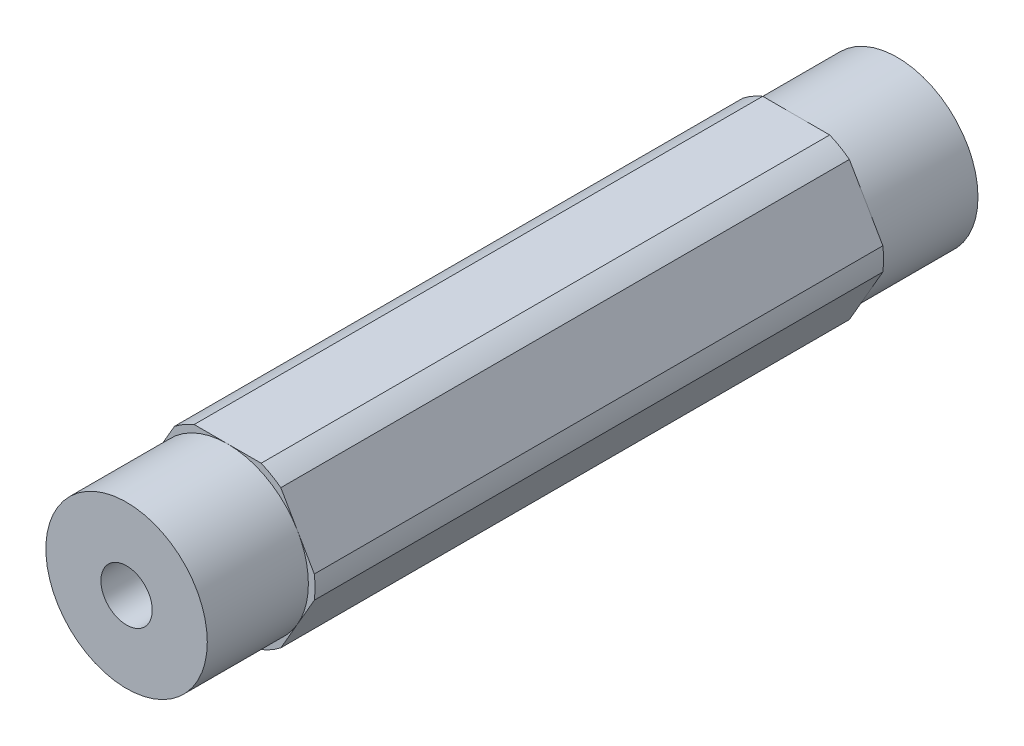
from build123d import *

# Parameters (mm, degrees)
BOSS_EXTRUDE1_DEPTH = 30.31109
SKETCH2_OUTSIDE_W   = 29.394
SKETCH2_OUTSIDE_H   = 27.43
SKETCH2_OUTSIDE_R   = 6.35
CUT_EXTRUDE2_DEPTH  = 7.9502
SKETCH3_OUTSIDE_W   = 29.394
SKETCH3_OUTSIDE_H   = 27.43
SKETCH3_OUTSIDE_R   = 6.875
CUT_EXTRUDE4_DEPTH  = 62.393277656
SKETCH4_R           = 2.0193
CUT_EXTRUDE5_DEPTH  = 62.340336101


with BuildPart() as part:
    # Sketch1 → Boss-Extrude1 (new, symmetric)
    with BuildSketch(Plane.XY):
        Polygon((7.332348419, 0), (3.666174209, 6.35), (-3.666174209, 6.35), (-7.332348419, 0), (-3.666174209, -6.35), (3.666174209, -6.35), align=None)
    extrude(amount=BOSS_EXTRUDE1_DEPTH, both=True)

    # Sketch2 outside → Cut-Extrude2 (cut)
    with BuildSketch(Plane.XY.offset(30.31109)):
        Rectangle(SKETCH2_OUTSIDE_W, SKETCH2_OUTSIDE_H)
        Circle(SKETCH2_OUTSIDE_R, mode=Mode.SUBTRACT)
    cut_extrude2 = extrude(amount=-CUT_EXTRUDE2_DEPTH, mode=Mode.SUBTRACT)

    # Sketch3 outside → Cut-Extrude4 (cut, through all)
    with BuildSketch(Plane.XY.offset(30.31109)):
        Rectangle(SKETCH3_OUTSIDE_W, SKETCH3_OUTSIDE_H)
        Circle(SKETCH3_OUTSIDE_R, mode=Mode.SUBTRACT)
    extrude(amount=-CUT_EXTRUDE4_DEPTH, mode=Mode.SUBTRACT)

    # Mirror1: Cut-Extrude2 across plane
    add(cut_extrude2.mirror(Plane.XY), mode=Mode.SUBTRACT)

    # Sketch4 → Cut-Extrude5 (cut, through all)
    with BuildSketch(Plane.XY.offset(30.31109)):
        Circle(SKETCH4_R)
    extrude(amount=-CUT_EXTRUDE5_DEPTH, mode=Mode.SUBTRACT)


solid = part.part
